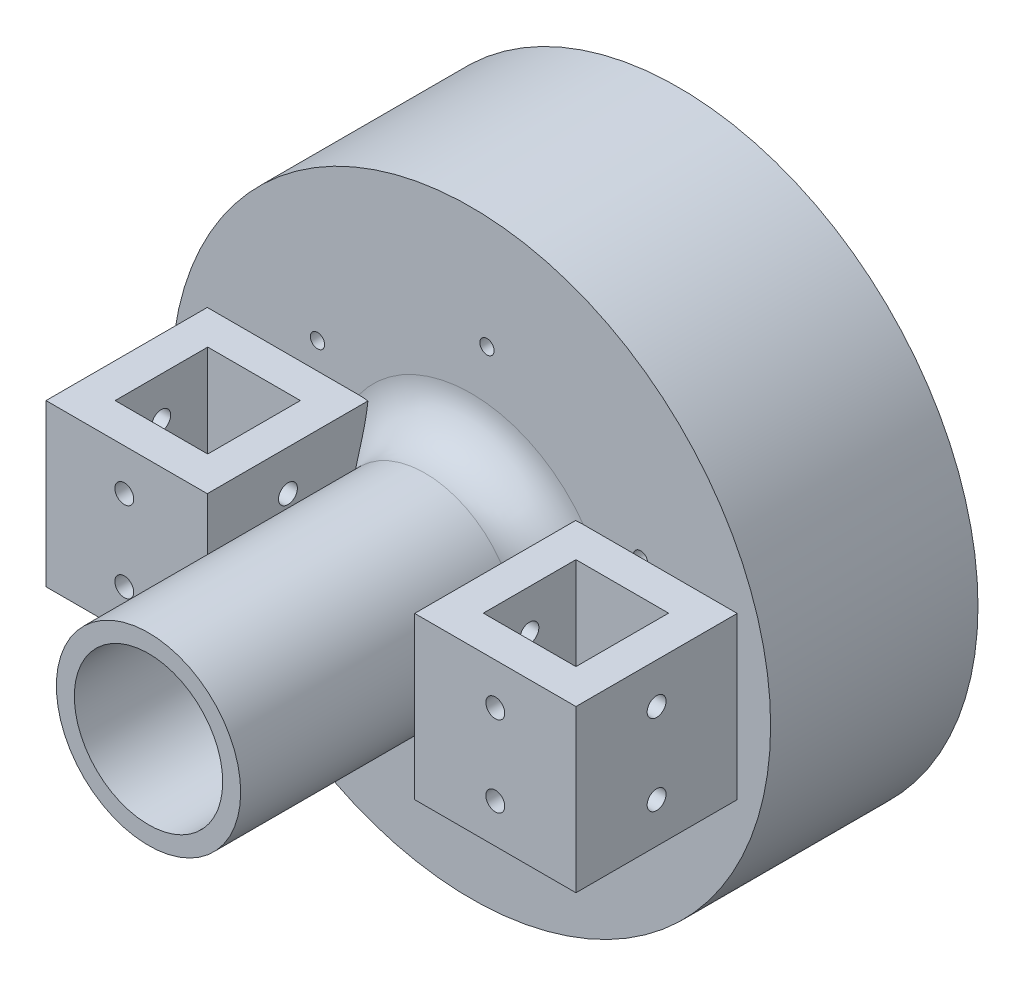
from build123d import *

# Parameters (mm, degrees)
SKETCH1_R               = 65
SKETCH1_R_2             = 1.55
SKETCH1_R_3             = 16.5
BOSS_EXTRUDE1_DEPTH     = 10
SKETCH2_R               = 20
SKETCH2_R_2             = 16.1
BOSS_EXTRUDE2_DEPTH     = 70
BOSS_EXTRUDE3_START     = 35
SKETCH3_R               = 65
SKETCH3_R_2             = 45.25
BOSS_EXTRUDE3_DEPTH     = 35
SKETCH4_W               = 35
SKETCH4_H               = 35
BOSS_EXTRUDE4_DEPTH     = 35
SKETCH5_W               = 20.1
SKETCH5_H               = 20.1
CUT_EXTRUDE1_DEPTH      = 40
FILLET1_R               = 10
SKETCH6_R               = 2.05
CUT_EXTRUDE2_DEPTH      = 127
CUT_EXTRUDE3_DEPTH      = 1
CUT_EXTRUDE3_DEPTH_BACK = 16
SKETCH7_R               = 2.05


with BuildPart() as part:
    # Sketch1 → Boss-Extrude1 (new body)
    with BuildSketch(Plane.XY):
        Circle(SKETCH1_R)
        with Locations((-3.448790634, -40.478847481)):
            Circle(SKETCH1_R_2, mode=Mode.SUBTRACT)
        Circle(SKETCH1_R_3, mode=Mode.SUBTRACT)
        with Locations((-36.780105552, -17.252683439)):
            Circle(SKETCH1_R_2, mode=Mode.SUBTRACT)
        with Locations((-33.331314918, 23.226164042)):
            Circle(SKETCH1_R_2, mode=Mode.SUBTRACT)
        with Locations((3.448790634, 40.478847481)):
            Circle(SKETCH1_R_2, mode=Mode.SUBTRACT)
        with Locations((36.780105552, 17.252683439)):
            Circle(SKETCH1_R_2, mode=Mode.SUBTRACT)
        with Locations((33.331314918, -23.226164042)):
            Circle(SKETCH1_R_2, mode=Mode.SUBTRACT)
    extrude(amount=BOSS_EXTRUDE1_DEPTH)

    # Sketch2 → Boss-Extrude2 (add)
    with BuildSketch(Plane.XY.offset(10)):
        Circle(SKETCH2_R)
        Circle(SKETCH2_R_2, mode=Mode.SUBTRACT)
    extrude(amount=BOSS_EXTRUDE2_DEPTH)

    # Sketch3 → Boss-Extrude3 (add)
    with BuildSketch(Plane(origin=(0, 0, 0), x_dir=(-1, 0, 0), z_dir=(0, 0, -1)).offset(BOSS_EXTRUDE3_START)):
        Circle(SKETCH3_R)
        Circle(SKETCH3_R_2, mode=Mode.SUBTRACT)
    extrude(amount=-BOSS_EXTRUDE3_DEPTH)

    # Sketch4 → Boss-Extrude4 (add)
    with BuildSketch(Plane.XY.offset(10)):
        with Locations((-39.74569159, 0)):
            Rectangle(SKETCH4_W, SKETCH4_H)
        with Locations((40.25430841, 0)):
            Rectangle(SKETCH4_W, SKETCH4_H)
    extrude(amount=BOSS_EXTRUDE4_DEPTH)

    # Sketch5 → Cut-Extrude1 (cut)
    with BuildSketch(Plane(origin=(0, 17.5, 0), x_dir=(1, 0, 0), z_dir=(0, 1, 0))):
        with Locations((40.20430841, -27.45)):
            Rectangle(SKETCH5_W, SKETCH5_H)
        with Locations((-39.69569159, -27.45)):
            Rectangle(SKETCH5_W, SKETCH5_H)
    extrude(amount=-CUT_EXTRUDE1_DEPTH, mode=Mode.SUBTRACT)

    # Fillet1
    # the kernel refuses this fillet: 10 mm, written as the material it adds along each edge
    with BuildSketch(Plane(origin=(0, 0, 10), x_dir=(1, 0, 0), z_dir=(0, -1, 0))) as fillet1_piece_1:
        with BuildLine():
            CenterArc((20 + FILLET1_R, FILLET1_R), FILLET1_R, 180, 90)
            Line((20, FILLET1_R), (20, 0))
            Line((20, 0), (20 + FILLET1_R, 0))
        make_face()
    revolve(axis=Axis((0, 0, 10), (0, 0, 1)))

    # Sketch6 → Cut-Extrude2 (cut)
    with BuildSketch(Plane(origin=(57.75430841, 0, 0), x_dir=(0, 0, -1), z_dir=(1, 0, 0))):
        with Locations(Location((-27.5, 8.75, 0), (0, 0, 90))):
            Circle(SKETCH6_R)
        with Locations(Location((-27.5, -8.75, 0), (0, 0, 90))):
            Circle(SKETCH6_R)
    extrude(amount=-CUT_EXTRUDE2_DEPTH, mode=Mode.SUBTRACT)

    # Sketch7 → Cut-Extrude3 (cut, two sides: drawn at the far end of the back side and taken through both)
    with BuildSketch(Plane.XY.offset(45).offset(-CUT_EXTRUDE3_DEPTH_BACK)):
        with Locations((40.25430841, 8.5)):
            Circle(SKETCH7_R)
        with Locations((40.25430841, -9)):
            Circle(SKETCH7_R)
        with Locations((-40.25430841, -9)):
            Circle(SKETCH7_R)
        with Locations((-40.25430841, 8.5)):
            Circle(SKETCH7_R)
    extrude(amount=CUT_EXTRUDE3_DEPTH + CUT_EXTRUDE3_DEPTH_BACK, mode=Mode.SUBTRACT)


solid = part.part
